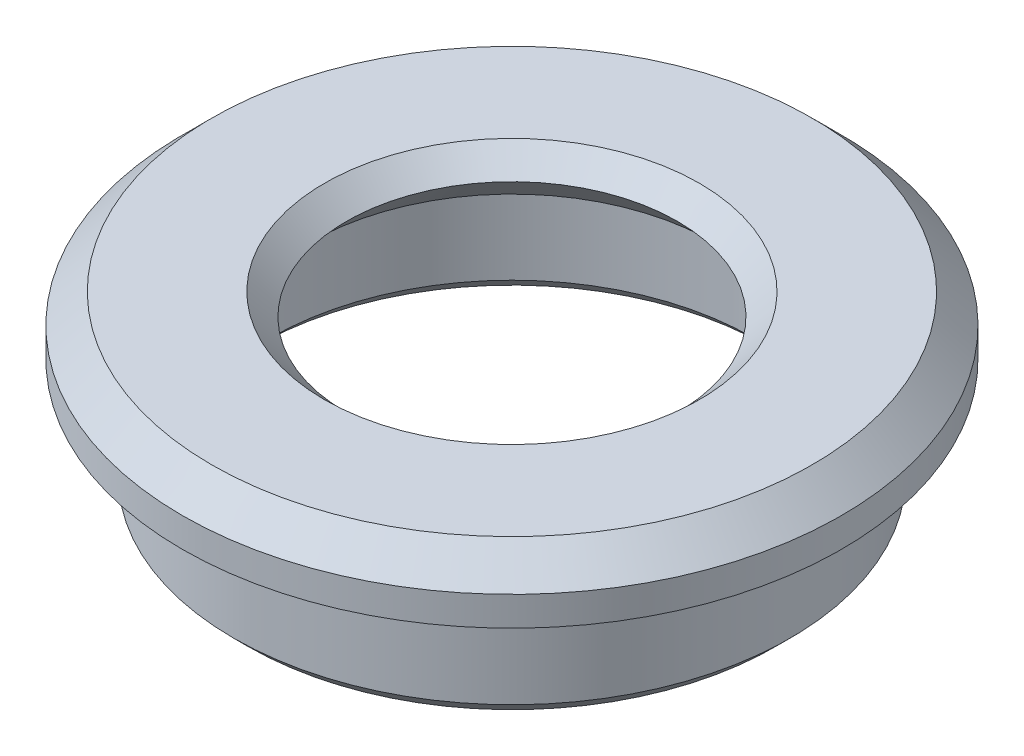
from build123d import *

# Parameters (mm, degrees)
SKETCH1_R               = 9.5
SKETCH1_R_2             = 8.25
BOSS_EXTRUDE1_DEPTH     = 4
SKETCH2_R               = 11.25
BOSS_EXTRUDE2_DEPTH     = 2
CUT_EXTRUDE1_DEPTH      = 18.003676073
CUT_EXTRUDE1_DEPTH_BACK = 18.003676073
SKETCH3_R               = 5.4
CHAMFER1_SIZE           = 1.5
CHAMFER2_SIZE           = 0.5
CHAMFER3_SIZE           = 1


with BuildPart() as part:
    # Sketch1 → Boss-Extrude1 (new body)
    with BuildSketch(Plane(origin=(0, 0, 0), x_dir=(1, 0, 0), z_dir=(0, 1, 0))):
        with Locations(Location((0, 0, 0), (0, 0, 270))):
            Circle(SKETCH1_R)
        with Locations(Location((0, 0, 0), (0, 0, 270))):
            Circle(SKETCH1_R_2, mode=Mode.SUBTRACT)
    extrude(amount=BOSS_EXTRUDE1_DEPTH)

    # Sketch2 → Boss-Extrude2 (add)
    with BuildSketch(Plane(origin=(0, 4, 0), x_dir=(1, 0, 0), z_dir=(0, 1, 0))):
        with Locations(Location((0, 0, 0), (0, 0, 270))):
            Circle(SKETCH2_R)
    extrude(amount=BOSS_EXTRUDE2_DEPTH)

    # Sketch3 → Cut-Extrude1 (cut, two sides: drawn at the far end of the back side and taken through both)
    with BuildSketch(Plane(origin=(0, 6, 0), x_dir=(1, 0, 0), z_dir=(0, 1, 0)).offset(-CUT_EXTRUDE1_DEPTH_BACK)):
        with Locations(Location((0, 0, 0), (0, 0, 270))):
            Circle(SKETCH3_R)
    extrude(amount=CUT_EXTRUDE1_DEPTH + CUT_EXTRUDE1_DEPTH_BACK, mode=Mode.SUBTRACT)

    # Chamfer1
    chamfer1_edges = [part.edges().sort_by_distance(p)[0] for p in [
        (0, 4, -5.4),
    ]]
    chamfer(chamfer1_edges, length=CHAMFER1_SIZE)

    # Chamfer2
    chamfer2_edges = [part.edges().sort_by_distance(p)[0] for p in [
        (0, 0, -9.5),
        (0, 0, -8.25),
    ]]
    chamfer(chamfer2_edges, length=CHAMFER2_SIZE)

    # Chamfer3
    # the kernel refuses this chamfer: 1 mm, written as the material it takes off along each edge
    with BuildSketch(Plane(origin=(0, 6, 0), x_dir=(0, 0, 1), z_dir=(-1, 0, 0))) as chamfer3_piece_1:
        Polygon((11.25 - CHAMFER3_SIZE, 0), (11.25, -CHAMFER3_SIZE), (11.25, 0), align=None)
    revolve(axis=Axis((0, 6, 0), (0, 1, 0)), mode=Mode.SUBTRACT)
    with BuildSketch(Plane(origin=(0, 6, 0), x_dir=(0, 0, 1), z_dir=(-1, 0, 0))) as chamfer3_piece_2:
        Polygon((5.4, -CHAMFER3_SIZE), (5.4 + CHAMFER3_SIZE, 0), (5.4, 0), align=None)
    revolve(axis=Axis((0, 6, 0), (0, 1, 0)), mode=Mode.SUBTRACT)


solid = part.part
